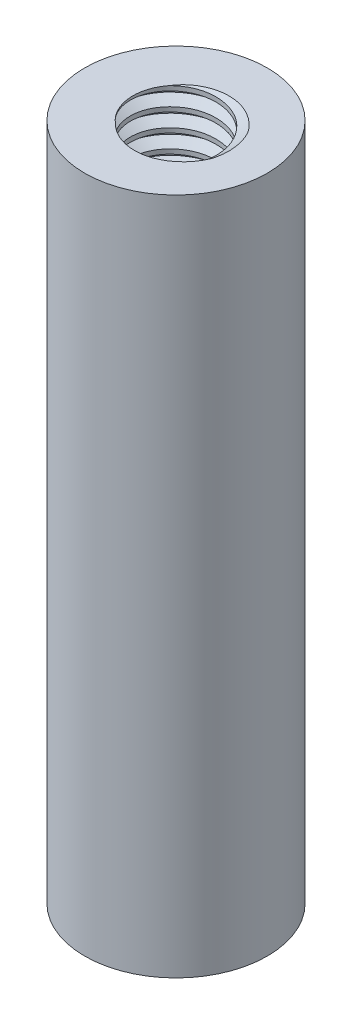
from build123d import *

# Parameters (mm, degrees)
SKETCH1_R           = 3.5
BOSS_EXTRUDE1_DEPTH = 13
SKETCH2_R           = 1.65
CUT_EXTRUDE1_DEPTH  = 6.5
THREAD1_PITCH       = 0.7
THREAD2_PITCH       = 0.7


with BuildPart() as part:
    # Sketch1 → Boss-Extrude1 (new, symmetric)
    with BuildSketch(Plane(origin=(0, 0, 0), x_dir=(1, 0, 0), z_dir=(0, 1, 0))):
        with Locations(Location((0, 0, 0), (0, 0, 90))):
            Circle(SKETCH1_R)
    extrude(amount=BOSS_EXTRUDE1_DEPTH, both=True)

    # Sketch2 → Cut-Extrude1 (cut)
    with BuildSketch(Plane(origin=(0, 13, 0), x_dir=(1, 0, 0), z_dir=(0, 1, 0))):
        with Locations(Location((0, 0, 0), (0, 0, 270))):
            Circle(SKETCH2_R)
    cut_extrude1 = extrude(amount=-CUT_EXTRUDE1_DEPTH, mode=Mode.SUBTRACT)

    # Thread1: the profile of Thread Profile1 profile screwed along a right-hand helix of 11.428571 turns, 6 arcs to a turn; built about Z, then put on its axis
    thread1_z = Axis((0, 0, 0), (0, 0, 1))
    thread1_corners = [(1.6497, 0, -0.000173205), (2.028886112, 0, 0.218749999), (2.028886112, 0, 0.306249999), (1.6497, 0, 0.525173203)]
    with BuildLine(mode=Mode.PRIVATE) as thread1_profile:
        Line(thread1_corners[0], thread1_corners[1])
        Line(thread1_corners[1], thread1_corners[2])
        Line(thread1_corners[2], thread1_corners[3])
        Line(thread1_corners[3], thread1_corners[0])
    thread1_cap = Face(thread1_profile.wire())
    thread1_turn_angles = [0, 30, 60, 90, 120, 150, 180, 210, 240, 270, 300, 330, 360]
    thread1_turn_weights = [1, 0.8660254037844387, 1, 0.8660254037844387, 1, 0.8660254037844387, 1, 0.8660254037844387, 1, 0.8660254037844387, 1, 0.8660254037844387, 1]
    thread1_turn_rails = [Edge.make_bspline([Vector(p[0], p[1], 0).rotate(thread1_z, thread1_turn_angles[k]) / thread1_turn_weights[k] + Vector(0, 0, p[2] + THREAD1_PITCH * thread1_turn_angles[k] / 360) for k in range(13)], [0, 0, 0, 1, 1, 2, 2, 3, 3, 4, 4, 5, 5, 6, 6, 6], 2, thread1_turn_weights) for p in thread1_corners]
    thread1_turn_sides = [Face.make_surface_from_curves(thread1_turn_rails[p[0]], thread1_turn_rails[p[1]]) for p in [(0, 1), (1, 2), (2, 3), (3, 0)]]
    thread1_last_angles = [3960, 3990, 4020, 4050, 4080, 4097.142857143, 4114.285714286]
    thread1_last_weights = [1, 0.8660254037844387, 1, 0.8660254037844387, 1, 0.9555728057861397, 1]
    thread1_last_rails = [Edge.make_bspline([Vector(p[0], p[1], 0).rotate(thread1_z, thread1_last_angles[k]) / thread1_last_weights[k] + Vector(0, 0, p[2] + THREAD1_PITCH * thread1_last_angles[k] / 360) for k in range(7)], [0, 0, 0, 1, 1, 2, 2, 3, 3, 3], 2, thread1_last_weights) for p in thread1_corners]
    thread1_last_sides = [Face.make_surface_from_curves(thread1_last_rails[p[0]], thread1_last_rails[p[1]]) for p in [(0, 1), (1, 2), (2, 3), (3, 0)]]
    thread1 = Plane(origin=(0, 15, 0), x_dir=(-1, 0, 0), z_dir=(0, -1, 0)) * Solid(Shell([*[p.moved(Location((0, 0, THREAD1_PITCH * i))) for i in range(11) for p in thread1_turn_sides], *thread1_last_sides, thread1_cap, thread1_cap.rotate(thread1_z, 4114.285714286).moved(Location((0, 0, THREAD1_PITCH * 4114.285714286 / 360)))]))
    add(thread1, mode=Mode.SUBTRACT)

    # Mirror3: Cut-Extrude1 across plane
    add(cut_extrude1.mirror(Plane.ZX), mode=Mode.SUBTRACT)

    # Thread2: the profile of Thread Profile2 profile screwed along a right-hand helix of 11.428571 turns, 6 arcs to a turn; built about Z, then put on its axis
    thread2_z = Axis((0, 0, 0), (0, 0, 1))
    thread2_corners = [(1.6497, 0, -0.000173205), (2.028886112, 0, 0.218749999), (2.028886112, 0, 0.306249999), (1.6497, 0, 0.525173203)]
    with BuildLine(mode=Mode.PRIVATE) as thread2_profile:
        Line(thread2_corners[0], thread2_corners[1])
        Line(thread2_corners[1], thread2_corners[2])
        Line(thread2_corners[2], thread2_corners[3])
        Line(thread2_corners[3], thread2_corners[0])
    thread2_cap = Face(thread2_profile.wire())
    thread2_turn_angles = [0, 30, 60, 90, 120, 150, 180, 210, 240, 270, 300, 330, 360]
    thread2_turn_weights = [1, 0.8660254037844387, 1, 0.8660254037844387, 1, 0.8660254037844387, 1, 0.8660254037844387, 1, 0.8660254037844387, 1, 0.8660254037844387, 1]
    thread2_turn_rails = [Edge.make_bspline([Vector(p[0], p[1], 0).rotate(thread2_z, thread2_turn_angles[k]) / thread2_turn_weights[k] + Vector(0, 0, p[2] + THREAD2_PITCH * thread2_turn_angles[k] / 360) for k in range(13)], [0, 0, 0, 1, 1, 2, 2, 3, 3, 4, 4, 5, 5, 6, 6, 6], 2, thread2_turn_weights) for p in thread2_corners]
    thread2_turn_sides = [Face.make_surface_from_curves(thread2_turn_rails[p[0]], thread2_turn_rails[p[1]]) for p in [(0, 1), (1, 2), (2, 3), (3, 0)]]
    thread2_last_angles = [3960, 3990, 4020, 4050, 4080, 4097.142857143, 4114.285714286]
    thread2_last_weights = [1, 0.8660254037844387, 1, 0.8660254037844387, 1, 0.9555728057861397, 1]
    thread2_last_rails = [Edge.make_bspline([Vector(p[0], p[1], 0).rotate(thread2_z, thread2_last_angles[k]) / thread2_last_weights[k] + Vector(0, 0, p[2] + THREAD2_PITCH * thread2_last_angles[k] / 360) for k in range(7)], [0, 0, 0, 1, 1, 2, 2, 3, 3, 3], 2, thread2_last_weights) for p in thread2_corners]
    thread2_last_sides = [Face.make_surface_from_curves(thread2_last_rails[p[0]], thread2_last_rails[p[1]]) for p in [(0, 1), (1, 2), (2, 3), (3, 0)]]
    thread2 = Plane(origin=(0, -15, 0), x_dir=(1, 0, 0), z_dir=(0, 1, 0)) * Solid(Shell([*[p.moved(Location((0, 0, THREAD2_PITCH * i))) for i in range(11) for p in thread2_turn_sides], *thread2_last_sides, thread2_cap, thread2_cap.rotate(thread2_z, 4114.285714286).moved(Location((0, 0, THREAD2_PITCH * 4114.285714286 / 360)))]))
    add(thread2, mode=Mode.SUBTRACT)


solid = part.part
